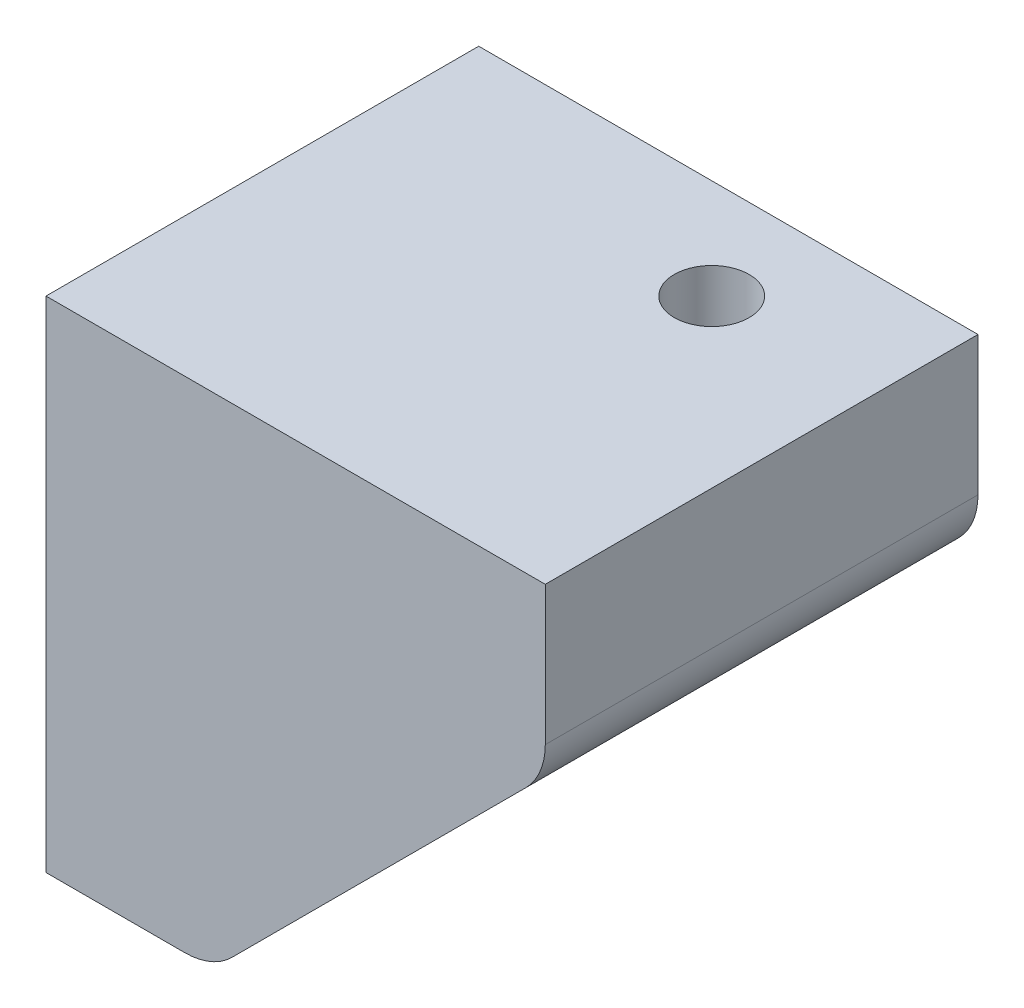
from build123d import *

# Parameters (mm, degrees)
BOSS_EXTRUDE1_DEPTH = 26
SKETCH3_R           = 2.25
CUT_EXTRUDE1_DEPTH  = 50.759421218
SKETCH2_R           = 2.5
CUT_EXTRUDE2_DEPTH  = 50.759421218
SKETCH4_R           = 5
CUT_EXTRUDE3_DEPTH  = 45.452221542
SKETCH5_R           = 4
CUT_EXTRUDE4_DEPTH  = 45.452221542
CHAMFER1_SIZE       = 3
FILLET2_R           = 4


with BuildPart() as part:
    # Sketch1 → Boss-Extrude1 (new body)
    with BuildSketch(Plane.XY):
        Polygon((0, 0), (10, 0), (30, 20), (30, 30), (0, 30), align=None)
    extrude(amount=BOSS_EXTRUDE1_DEPTH)

    # Sketch3 → Cut-Extrude1 (cut, through all)
    with BuildSketch(Plane(origin=(0, 30, 0), x_dir=(1, 0, 0), z_dir=(0, 1, 0))):
        with Locations(Location((20, -6, 0), (0, 0, 180))):
            Circle(SKETCH3_R)
    extrude(amount=-CUT_EXTRUDE1_DEPTH, mode=Mode.SUBTRACT)

    # Sketch2 → Cut-Extrude2 (cut, through all)
    with BuildSketch(Plane.ZY):
        with Locations(Location((18, 10, 0), (0, 0, 270))):
            Circle(SKETCH2_R)
    extrude(amount=-CUT_EXTRUDE2_DEPTH, mode=Mode.SUBTRACT)

    # Sketch4 → Cut-Extrude3 (cut, through all)
    with BuildSketch(Plane.ZY.offset(-10)):
        with Locations(Location((18, 10, 0), (0, 0, 270))):
            Circle(SKETCH4_R)
    extrude(amount=-CUT_EXTRUDE3_DEPTH, mode=Mode.SUBTRACT)

    # Sketch5 → Cut-Extrude4 (cut, through all)
    with BuildSketch(Plane(origin=(0, 20, 0), x_dir=(1, 0, 0), z_dir=(0, 1, 0))):
        with Locations(Location((20, -6, 0), (0, 0, 180))):
            Circle(SKETCH5_R)
    extrude(amount=-CUT_EXTRUDE4_DEPTH, mode=Mode.SUBTRACT)

    # Chamfer1
    # the kernel refuses this chamfer: 3 mm, written as the material it adds along each edge
    with BuildSketch(Plane(origin=(10, 10, 18), x_dir=(0, -1, 0), z_dir=(0, 0, -1))) as chamfer1_piece_1_section:
        Polygon((5, -CHAMFER1_SIZE), (5 - CHAMFER1_SIZE, 0), (5, 0), align=None)
    chamfer1_piece_1 = revolve(axis=Axis((10, 10, 18), (-1, 0, 0)), mode=Mode.PRIVATE)
    chamfer1_piece_1 = chamfer1_piece_1 - Plane(origin=(11.757355127, 10, 18), x_dir=(0, -1, 0), z_dir=(-1, 0, 0)) * Cylinder(2.5, 20, mode=Mode.PRIVATE)
    add(chamfer1_piece_1)

    # Fillet2
    fillet2_edges = [part.edges().sort_by_distance(p)[0] for p in [
        (30, 20, 13),
        (10, 0, 13),
    ]]
    fillet(fillet2_edges, radius=FILLET2_R)


solid = part.part
